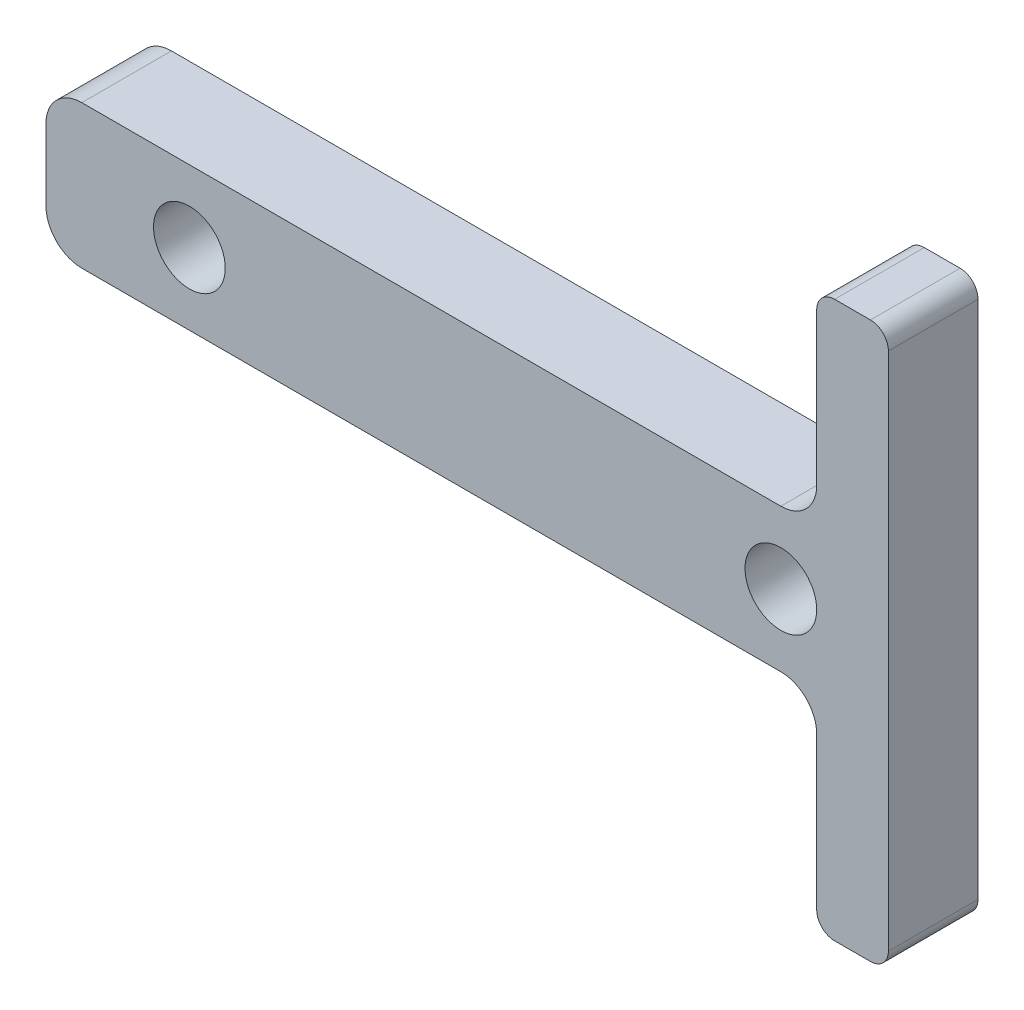
from build123d import *

# Parameters (mm, degrees)
BOSS_EXTRUDE1_DEPTH = 5
SKETCH2_R           = 2
CUT_EXTRUDE1_DEPTH  = 33.488459489


with BuildPart() as part:
    # Sketch1 → Boss-Extrude1 (new body)
    with BuildSketch(Plane.XY):
        with BuildLine():
            Line((-19.5, 0), (19.5, 0))
            ThreePointArc((19.5, 0), (20.914213562, 0.585786438), (21.5, 2))
            Line((21.5, 2), (21.5, 10.5))
            ThreePointArc((21.5, 10.5), (21.792893219, 11.207106781), (22.5, 11.5))
            Line((22.5, 11.5), (24.5, 11.5))
            ThreePointArc((24.5, 11.5), (25.207106781, 11.207106781), (25.5, 10.5))
            Line((25.5, 10.5), (25.5, -18.5))
            ThreePointArc((25.5, -18.5), (25.207106781, -19.207106781), (24.5, -19.5))
            Line((24.5, -19.5), (22.5, -19.5))
            ThreePointArc((22.5, -19.5), (21.792893219, -19.207106781), (21.5, -18.5))
            Line((21.5, -18.5), (21.5, -10))
            ThreePointArc((21.5, -10), (20.914213562, -8.585786438), (19.5, -8))
            Line((19.5, -8), (-19.5, -8))
            ThreePointArc((-19.5, -8), (-20.914213562, -7.414213562), (-21.5, -6))
            Line((-21.5, -6), (-21.5, -2))
            ThreePointArc((-21.5, -2), (-20.914213562, -0.585786438), (-19.5, 0))
        make_face()
    extrude(amount=BOSS_EXTRUDE1_DEPTH)

    # Sketch2 → Cut-Extrude1 (cut, through all)
    with BuildSketch(Plane.XY.offset(5)):
        with Locations((-13.5, -4)):
            Circle(SKETCH2_R)
        with Locations((19.5, -4)):
            Circle(SKETCH2_R)
    extrude(amount=-CUT_EXTRUDE1_DEPTH, mode=Mode.SUBTRACT)


solid = part.part
